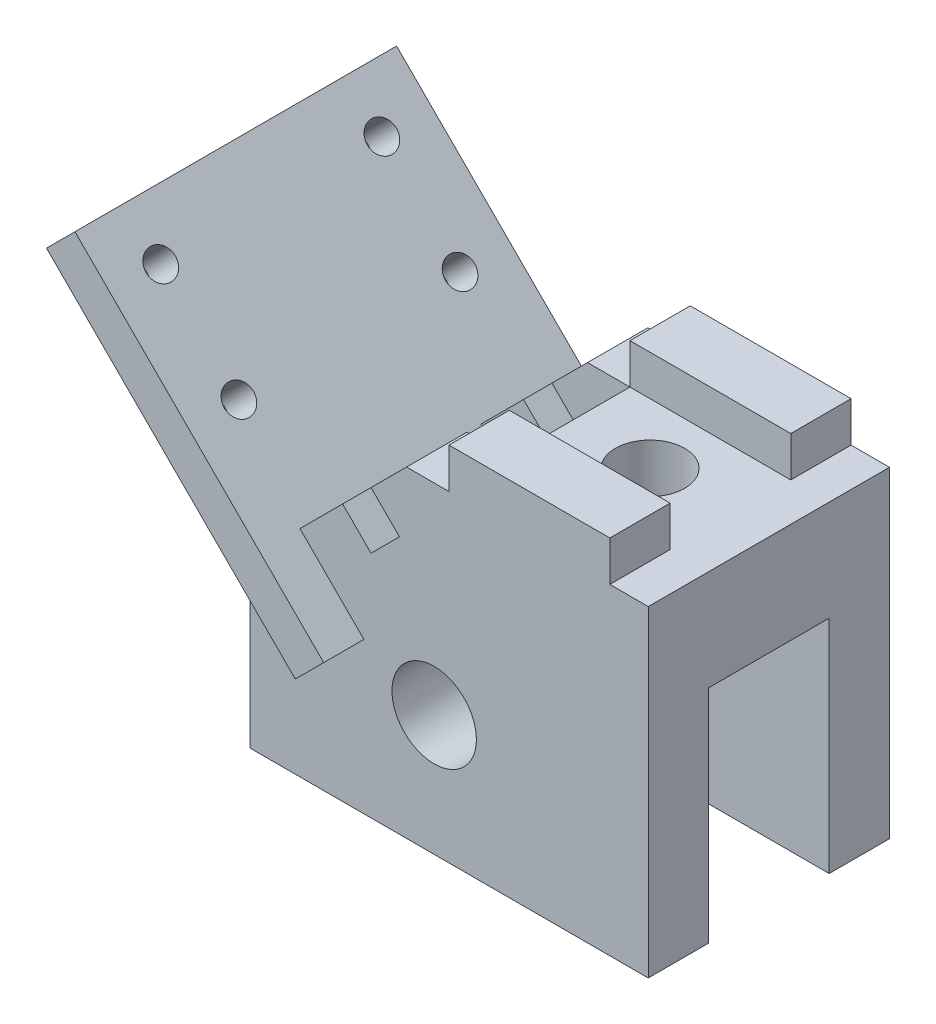
from build123d import *
from build123d.topology import SkipClean

# Parameters (mm, degrees)
SKETCH1_R                        = 2.1
FINGER_BASE_1_DEPTH              = 6
SKETCH2_W                        = 16
SKETCH2_H                        = 2
FLEXURE_JOINT_BASE_DEPTH         = 13
SKETCH3_W                        = 8
SKETCH3_H                        = 2
PULLEY_HOUSING_DEPTH             = 3
M3_NUT_DEPTH                     = 2
SKETCH5_R                        = 1.725
M3_HOLE_DEPTH                    = 3
SKETCH9_W                        = 2
SKETCH9_H                        = 2
SUPPORT_FLEXURE_JOINT_BASE_DEPTH = 4.5
SKETCH10_R                       = 0.725
HOLE_FOR_STICHING_DEPTH          = 22.391190815
CUT_EXTRUDE1_DEPTH               = 32.362649657
CUT_EXTRUDE1_DEPTH_BACK          = 32.362649657


with BuildPart() as part:
    # Sketch1 → Finger Base 1 (new, symmetric)
    with BuildSketch(Plane.XY):
        Polygon((0, 8.221825407), (7.778174593, 16), (9.889087297, 16), (9.889087297, 18), (17.889087297, 18), (17.889087297, 16), (19.8, 16), (19.8, 0), (0, 0), align=None)
        with Locations((9.151471863, 6)):
            Circle(SKETCH1_R, mode=Mode.SUBTRACT)
    extrude(amount=FINGER_BASE_1_DEPTH, both=True)

    # Sketch2 → Flexure Joint Base (add)
    with BuildSketch(Plane(origin=(-4.110912703, 4.110912703, 0), x_dir=(0, 0, 1), z_dir=(-0.7071067811865462, 0.707106781186549, 0))):
        with Locations((0, 8.313708499)):
            Rectangle(SKETCH2_W, SKETCH2_H)
    extrude(amount=FLEXURE_JOINT_BASE_DEPTH)

    # Sketch3 → Pulley Housing (cut, symmetric)
    with SkipClean():  # the faces are left unmerged after this step: merging them gives an invalid solid
        with BuildSketch(Plane.XY):
            with BuildLine():
                ThreePointArc((7.054725188, 6.116847687), (7.62579494, 4.556978889), (9.151471863, 3.9))
                Line((9.151471863, 3.9), (9.151471863, 0))
                Line((9.151471863, 0), (19.8, 0))
                Line((19.8, 0), (19.8, 11))
                Line((19.8, 11), (9.889087297, 11))
                Line((9.889087297, 11), (9.889087297, 16))
                Line((9.889087297, 16), (7.778174593, 16))
                Line((7.778174593, 16), (2.474873734, 10.696699141))
                Line((2.474873734, 10.696699141), (7.054725188, 6.116847687))
            make_face()
            with Locations((13.889087297, 17)):
                Rectangle(SKETCH3_W, SKETCH3_H)
        extrude(amount=PULLEY_HOUSING_DEPTH, both=True, mode=Mode.SUBTRACT)
    add(part.part.scale(1), mode=Mode.REPLACE)  # the faces are merged on a copy

    # Sketch4 → M3 Nut (cut)
    with BuildSketch(Plane.XZ.offset(-11)):
        Polygon((10.598190762, 0), (12.243639029, -2.85), (15.534535564, -2.85), (17.179983831, 0), (15.534535564, 2.85), (12.243639029, 2.85), align=None)
    extrude(amount=-M3_NUT_DEPTH, mode=Mode.SUBTRACT)

    # Sketch5 → M3 Hole (cut)
    with BuildSketch(Plane.XZ.offset(-13)):
        with Locations(Location((13.889087297, 0, 0), (0, 0, 270))):
            Circle(SKETCH5_R)
    extrude(amount=-M3_HOLE_DEPTH, mode=Mode.SUBTRACT)

    # Sketch9 → Support Flexure Joint Base (add)
    with BuildSketch(Plane(origin=(-4.110912703, 4.110912703, 0), x_dir=(0, 0, -1), z_dir=(0.7071067811865462, -0.7071067811865488, 0))):
        with Locations((-7, 8.313708499)):
            Rectangle(SKETCH9_W, SKETCH9_H)
        with Locations((7, 8.313708499)):
            Rectangle(SKETCH9_W, SKETCH9_H)
    extrude(amount=SUPPORT_FLEXURE_JOINT_BASE_DEPTH)

    # Sketch10 → Hole For Stiching (cut, through all)
    with BuildSketch(Plane(origin=(6.585786438, 6.585786438, 0), x_dir=(0.7071067811865462, -0.707106781186549, 0), z_dir=(0.707106781186549, 0.7071067811865462, 0))):
        with Locations(Location((-16.313708499, -5.5, 0), (0, 0, 180))):
            Circle(SKETCH10_R)
        with Locations(Location((-10.813708499, -5.5, 0), (0, 0, 180))):
            Circle(SKETCH10_R)
        with Locations(Location((-10.813708499, 5.5, 0), (0, 0, 180))):
            Circle(SKETCH10_R)
        with Locations(Location((-16.313708499, 5.5, 0), (0, 0, 180))):
            Circle(SKETCH10_R)
    extrude(amount=-HOLE_FOR_STICHING_DEPTH, mode=Mode.SUBTRACT)

    # Sketch11 → Cut-Extrude1 (cut, two sides: drawn at the far end of the back side and taken through both)
    with BuildSketch(Plane.XY.offset(6).offset(-CUT_EXTRUDE1_DEPTH_BACK)):
        Polygon((-30.849385448, 48.263599011), (4.596194078, 12.818019485), (6.01040764, 11.403805922), (7.424621202, 12.818019485), (6.01040764, 14.232233047), (-29.435171886, 49.677812573), (-100.326330938, 120.568971625), (-101.7405445, 119.154758062), align=None)
    extrude(amount=CUT_EXTRUDE1_DEPTH + CUT_EXTRUDE1_DEPTH_BACK, mode=Mode.SUBTRACT)


solid = part.part
